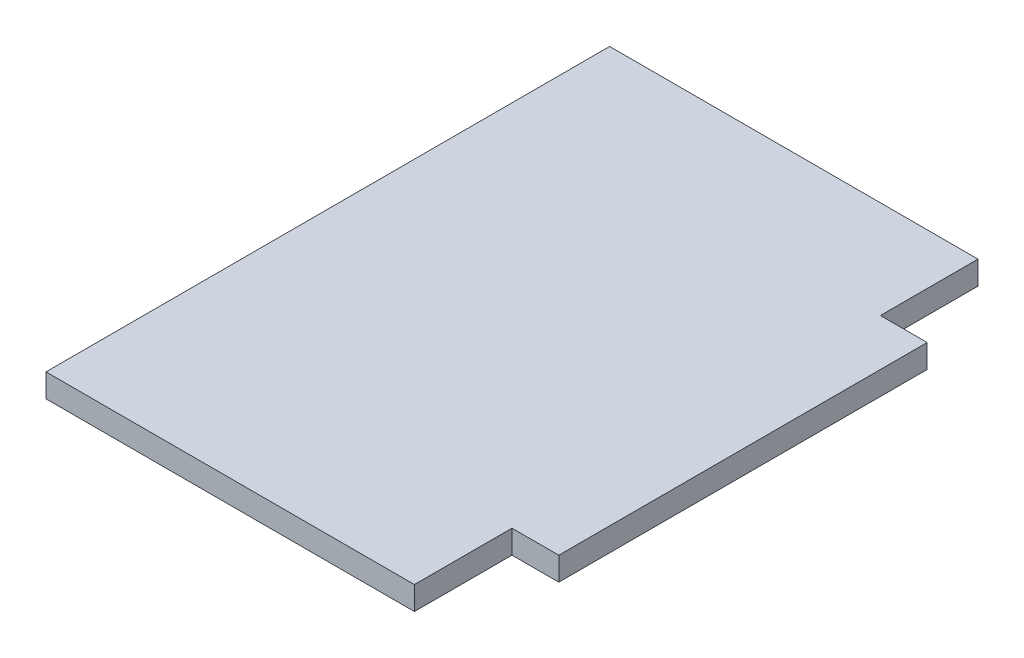
from build123d import *

# Parameters (mm, degrees)
BOSS_EXTRUDE1_DEPTH = 3.175


with BuildPart() as part:
    # Sketch1 → Boss-Extrude1 (new body)
    with BuildSketch(Plane(origin=(0, 0, 0), x_dir=(1, 0, 0), z_dir=(0, 1, 0))):
        Polygon((25, 13.25), (-25, 13.25), (-25, 0), (-25, -50), (-25, -63.25), (25, -63.25), (25, -50), (31.35, -50), (31.35, 0), (25, 0), align=None)
    extrude(amount=BOSS_EXTRUDE1_DEPTH)


solid = part.part
